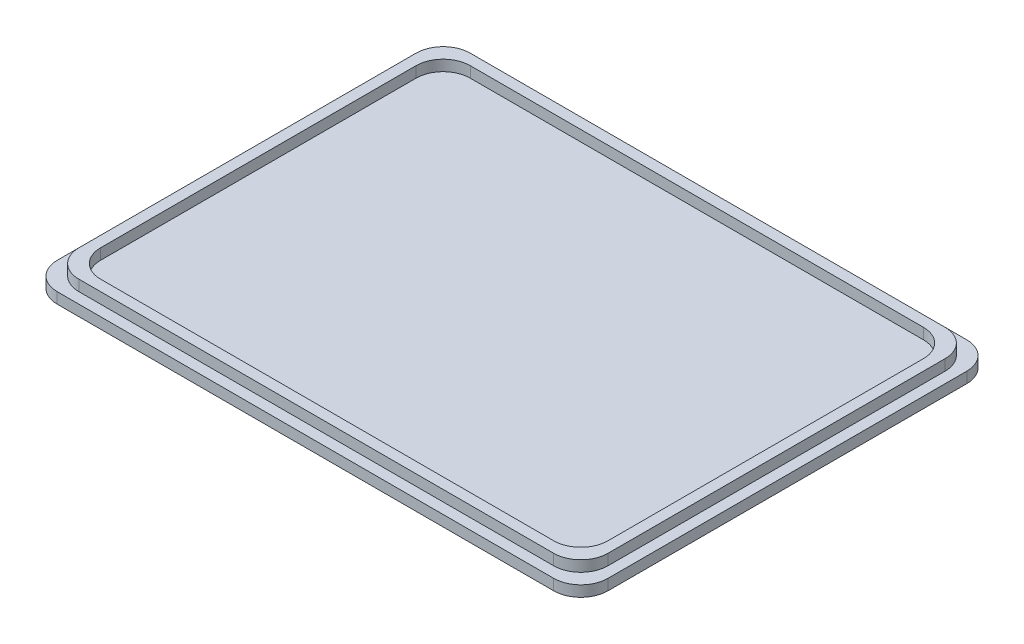
from build123d import *

# Parameters (mm, degrees)
SKETCH1_W           = 101.6
SKETCH1_H           = 76.2
BOSS_EXTRUDE1_DEPTH = 2
SKETCH2_W           = 97.6
SKETCH2_H           = 72.2
SKETCH2_W_2         = 93.6
SKETCH2_H_2         = 68.2
EXTRUDE_THIN1_DEPTH = 2
FILLET1_R           = 5
FILLET2_R           = 5
CUT_EXTRUDE1_DEPTH  = 1


with BuildPart() as part:
    # Sketch1 → Boss-Extrude1 (new body)
    with BuildSketch(Plane(origin=(0, 0, 0), x_dir=(1, 0, 0), z_dir=(0, 1, 0))):
        Rectangle(SKETCH1_W, SKETCH1_H)
    extrude(amount=BOSS_EXTRUDE1_DEPTH)

    # Sketch2 → Extrude-Thin1 (add)
    with BuildSketch(Plane(origin=(0, 2, 0), x_dir=(1, 0, 0), z_dir=(0, 1, 0))):
        Rectangle(SKETCH2_W, SKETCH2_H)
        Rectangle(SKETCH2_W_2, SKETCH2_H_2, mode=Mode.SUBTRACT)
    extrude(amount=EXTRUDE_THIN1_DEPTH)

    # Fillet1
    fillet1_edges = [part.edges().sort_by_distance(p)[0] for p in [
        (-50.8, 1, -38.1),
        (-50.8, 1, 38.1),
        (50.8, 1, -38.1),
        (50.8, 1, 38.1),
    ]]
    fillet(fillet1_edges, radius=FILLET1_R)

    # Fillet2
    fillet2_edges = [part.edges().sort_by_distance(p)[0] for p in [
        (46.8, 3, -34.1),
        (46.8, 3, 34.1),
        (-46.8, 3, 34.1),
        (-46.8, 3, -34.1),
        (48.8, 3, -36.1),
        (48.8, 3, 36.1),
        (-48.8, 3, 36.1),
        (-48.8, 3, -36.1),
    ]]
    fillet(fillet2_edges, radius=FILLET2_R)

    # Sketch3 → Cut-Extrude1 (cut)
    # profile 1 of 2: a face of its own
    with BuildSketch(Plane.XZ):
        Polygon((-24.707892963, 11.5151785), (-37.000841681, 11.5151785), (-31.012099694, 24.540819526), (-30.701723091, 24.540819526), align=None)
        Polygon((-26.468389758, 12.65492209), (-30.854367322, 22.190098372), (-35.237800816, 12.65492209), align=None, mode=Mode.SUBTRACT)
    # profile 2 of 2: a face of its own
    with BuildSketch(Plane.XZ):
        Polygon((-16.444751938, 11.5151785), (-23.812380143, 11.5151785), (-20.263401777, 17.96185318), (-23.812380143, 24.2151785), (-16.60757245, 24.2151785), (-16.60757245, 22.912614398), (-21.797476297, 22.912614398), (-18.88705963, 17.783768244), (-21.708433829, 12.65492209), (-16.444751938, 12.65492209), align=None)
    extrude(amount=-CUT_EXTRUDE1_DEPTH, mode=Mode.SUBTRACT)


solid = part.part
